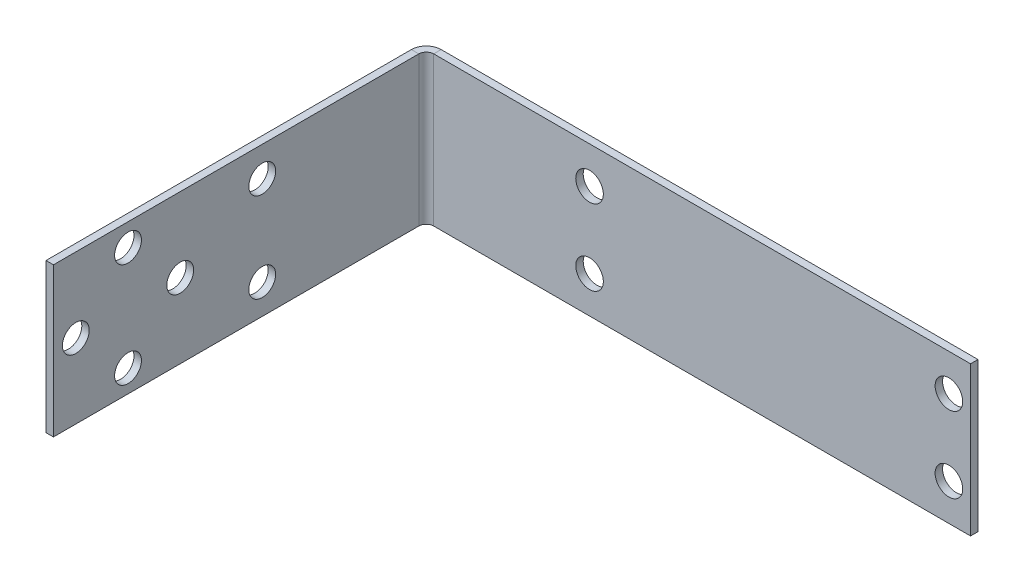
from build123d import *

# Parameters (mm, degrees)
EXTRUDE_1_DEPTH       = 20
SKETCH_22_R           = 1.8
CUT_EXTRUDE_1_DEPTH   = 93.070625066
SKETCH_23_R           = 1.85
CUT_EXTRUDE_2_DEPTH   = 93.876261768
SHEET_METAL_1_DEPTH   = 20
SHEET_METAL_1_2_DEPTH = 20
SKETCH_24_R           = 1.8
CUT_EXTRUDE_3_DEPTH   = 92.268833673


# Read off the part's stored shape, not the designer's step: 转换实体1
with BuildPart() as part:
    # Sketch 1 → 凸台-拉伸1 (new body)
    with BuildSketch(Plane(origin=(0, 0, 0), x_dir=(1, 0, 0), z_dir=(0, 1, 0))):
        Polygon((2, 0), (2, 50), (74, 50), (75, 50), (75, 51), (1, 51), (1, 0), align=None)
    extrude(amount=EXTRUDE_1_DEPTH)

    # 草图22 → 切除-拉伸1 (cut, through all)
    with BuildSketch(Plane.ZY.offset(-1)):
        with Locations((-17, 10)):
            Circle(SKETCH_22_R)
        with Locations((-10, 17)):
            Circle(SKETCH_22_R)
        with Locations((-3, 10)):
            Circle(SKETCH_22_R)
        with Locations((-10, 3)):
            Circle(SKETCH_22_R)
    extrude(amount=-CUT_EXTRUDE_1_DEPTH, mode=Mode.SUBTRACT)

    # 草图23 → 切除-拉伸2 (cut, through all)
    with BuildSketch(Plane(origin=(0, 0, -51), x_dir=(-1, 0, 0), z_dir=(0, 0, -1))):
        with Locations((-72.1, 15.075)):
            Circle(SKETCH_23_R)
        with Locations((-72.1, 4.925)):
            Circle(SKETCH_23_R)
        with Locations((-23.9, 4.925)):
            Circle(SKETCH_23_R)
        with Locations((-23.9, 15.075)):
            Circle(SKETCH_23_R)
    extrude(amount=-CUT_EXTRUDE_2_DEPTH, mode=Mode.SUBTRACT)

    # Sheet Metal 1 outline → Sheet Metal 1 (cut)
    with BuildSketch(Plane(origin=(0, 0, 0), x_dir=(1, 0, 0), z_dir=(0, 1, 0))):
        with BuildLine():
            Line((1, 51), (1, 49))
            ThreePointArc((1, 49), (1.585786438, 50.414213562), (3, 51))
            Line((3, 51), (1, 51))
        make_face()
    extrude(amount=SHEET_METAL_1_DEPTH, mode=Mode.SUBTRACT)

    # Sheet Metal 1 2 outline → Sheet Metal 1 2 (add)
    with BuildSketch(Plane(origin=(0, 0, 0), x_dir=(1, 0, 0), z_dir=(0, 1, 0))):
        with BuildLine():
            Line((2, 50), (2, 49))
            ThreePointArc((2, 49), (2.292893219, 49.707106781), (3, 50))
            Line((3, 50), (2, 50))
        make_face()
    extrude(amount=SHEET_METAL_1_2_DEPTH)

    # 草图24 → 切除-拉伸3 (cut, through all)
    with BuildSketch(Plane(origin=(2, 0, 0), x_dir=(0, 0, -1), z_dir=(1, 0, 0))):
        with Locations((28, 16)):
            Circle(SKETCH_24_R)
        with Locations((28, 4)):
            Circle(SKETCH_24_R)
    extrude(amount=-CUT_EXTRUDE_3_DEPTH, mode=Mode.SUBTRACT)


solid = part.part
